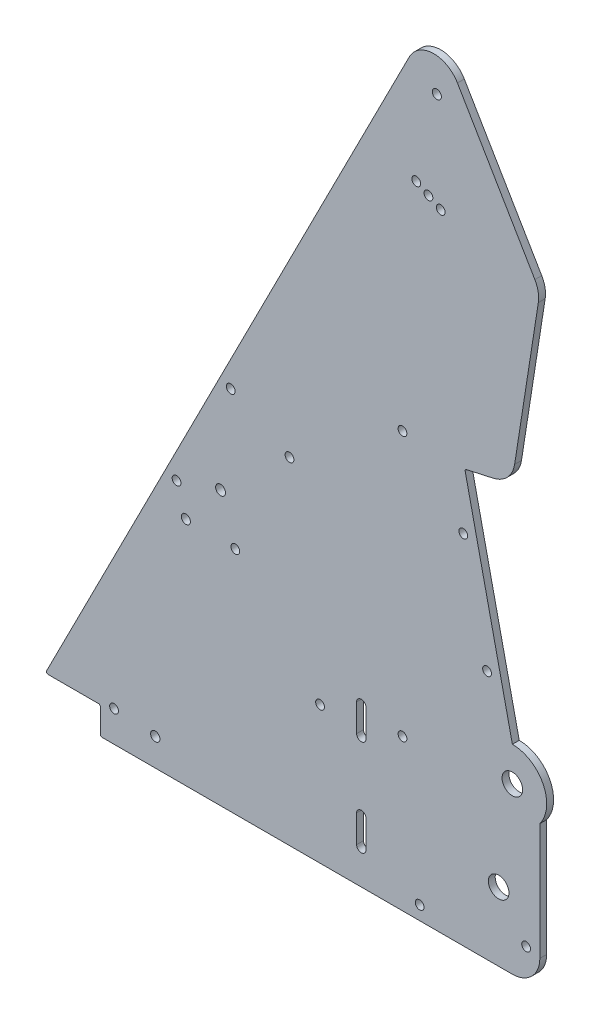
from build123d import *

# Parameters (mm, degrees)
BOSS_EXTRUDE1_DEPTH = 3.175
SKETCH2_R           = 2.0955
SKETCH2_R_2         = 2.286
SKETCH2_R_3         = 2.032
SKETCH2_R_4         = 4.7625
CUT_EXTRUDE1_DEPTH  = 421.976111717
SKETCH7_R           = 2.159
CUT_EXTRUDE2_DEPTH  = 421.976111717
CUT_EXTRUDE3_REACH  = 422.976
SKETCH10_R          = 2.032
FILLET1_R           = 12.7
FILLET2_R           = 0.79375
SKETCH12_R          = 2.032
CUT_EXTRUDE5_DEPTH  = 410.593447353


with BuildPart() as part:
    # Sketch1 → Boss-Extrude1 (new body)
    with BuildSketch(Plane.XY):
        with BuildLine():
            Line((228.6, -12.7), (228.6, 53.975))
            ThreePointArc((228.6, 53.975), (230.099031657, 70.599515829), (215.9, 79.375))
            Line((215.9, 79.375), (193.909735224, 178.566674323))
            Line((193.909735224, 178.566674323), (215.607913982, 183.377044743))
            Line((215.607913982, 183.377044743), (228.6, 266.7))
            Line((228.6, 266.7), (178.754725958, 351.413083686))
            Line((178.754725958, 351.413083686), (0, 0))
            Line((0, 0), (25.4, 0))
            Line((25.4, 0), (25.4, -12.7))
            Line((25.4, -12.7), (228.6, -12.7))
        make_face()
    extrude(amount=BOSS_EXTRUDE1_DEPTH)

    # Sketch2 → Cut-Extrude1 (cut, through all)
    with BuildSketch(Plane.XY.offset(3.175)):
        with Locations((64.943150167, 94.057839899)):
            Circle(SKETCH2_R)
        with Locations((180.975, 322.164313376)):
            Circle(SKETCH2_R)
        with Locations((81.00705334, 113.73297687)):
            Circle(SKETCH2_R_2)
        with Locations((193.207821773, 152.394364194)):
            Circle(SKETCH2_R_3)
        with Locations((215.9, 63.5)):
            Circle(SKETCH2_R_4)
        with Locations((173.0375, -6.35)):
            Circle(SKETCH2_R_3)
        with Locations((204.202954161, 102.798527032)):
            Circle(SKETCH2_R_3)
        with Locations((209.55, 19.05)):
            Circle(SKETCH2_R_4)
        with Locations((60.657757175, 107.341986975)):
            Circle(SKETCH2_R_3)
        with Locations((165.1, 179.3875)):
            Circle(SKETCH2_R_3)
        with Locations((87.824985877, 93.522721993)):
            Circle(SKETCH2_R_3)
        with Locations((112.872403657, 142.763324016)):
            Circle(SKETCH2_R_3)
        with Locations((85.705174955, 156.582588998)):
            Circle(SKETCH2_R_3)
        with Locations((171.45, 282.575)):
            Circle(SKETCH2_R_3)
        with Locations((177.109839313, 279.695986462)):
            Circle(SKETCH2_R_3)
        with Locations((182.769678626, 276.816972924)):
            Circle(SKETCH2_R_3)
    extrude(amount=-CUT_EXTRUDE1_DEPTH, mode=Mode.SUBTRACT)

    # Sketch7 → Cut-Extrude2 (cut, through all)
    with BuildSketch(Plane.XY.offset(3.175)):
        with Locations((50.8, 0)):
            Circle(SKETCH7_R)
        with BuildLine():
            Line((143.891, 3.175), (143.891, 15.875))
            ThreePointArc((143.891, 15.875), (146.05, 18.034), (148.209, 15.875))
            Line((148.209, 15.875), (148.209, 3.175))
            ThreePointArc((148.209, 3.175), (146.05, 1.016), (143.891, 3.175))
        make_face()
        with BuildLine():
            Line((143.891, 47.625), (143.891, 60.325))
            ThreePointArc((143.891, 60.325), (146.05, 62.484), (148.209, 60.325))
            Line((148.209, 60.325), (148.209, 47.625))
            ThreePointArc((148.209, 47.625), (146.05, 45.466), (143.891, 47.625))
        make_face()
    extrude(amount=-CUT_EXTRUDE2_DEPTH, mode=Mode.SUBTRACT)

    # Sketch10 → Cut-Extrude3 (cut, up to next)
    with BuildSketch(Plane.XY.offset(3.175), mode=Mode.PRIVATE) as cut_extrude3_sk1:
        with Locations((127, 50.8)):
            Circle(SKETCH10_R)
    cut_extrude3_tool1 = extrude(cut_extrude3_sk1.sketch, amount=-CUT_EXTRUDE3_REACH, mode=Mode.PRIVATE) & part.part
    # Sketch10 → Cut-Extrude3 (cut, up to next)
    with BuildSketch(Plane.XY.offset(3.175), mode=Mode.PRIVATE) as cut_extrude3_sk2:
        with Locations((165.1, 57.15)):
            Circle(SKETCH10_R)
    cut_extrude3_tool2 = extrude(cut_extrude3_sk2.sketch, amount=-CUT_EXTRUDE3_REACH, mode=Mode.PRIVATE) & part.part
    add(cut_extrude3_tool1.solids().sort_by_distance((127, 50.8, 3.175))[0], mode=Mode.SUBTRACT)
    add(cut_extrude3_tool2.solids().sort_by_distance((165.1, 57.15, 3.175))[0], mode=Mode.SUBTRACT)

    # Fillet1
    fillet1_edges = [part.edges().sort_by_distance(p)[0] for p in [
        (228.6, -12.7, 1.5875),
        (178.754725958, 351.413083686, 1.5875),
        (215.607913982, 183.377044743, 1.5875),
        (228.6, 266.7, 1.5875),
    ]]
    fillet(fillet1_edges, radius=FILLET1_R)

    # Fillet2
    fillet2_edges = [part.edges().sort_by_distance(p)[0] for p in [
        (25.4, -12.7, 1.5875),
        (25.4, 0, 1.5875),
        (193.909735224, 178.566674323, 1.5875),
        (0, 0, 1.5875),
    ]]
    fillet(fillet2_edges, radius=FILLET2_R)

    # Sketch12 → Cut-Extrude5 (cut, through all)
    with BuildSketch(Plane.XY.offset(3.175)):
        with Locations((31.75, 1.5875)):
            Circle(SKETCH12_R)
        with Locations((173.0375, -6.35)):
            Circle(SKETCH12_R)
        with Locations((222.25, 1.5875)):
            Circle(SKETCH12_R)
    extrude(amount=-CUT_EXTRUDE5_DEPTH, mode=Mode.SUBTRACT)


solid = part.part
